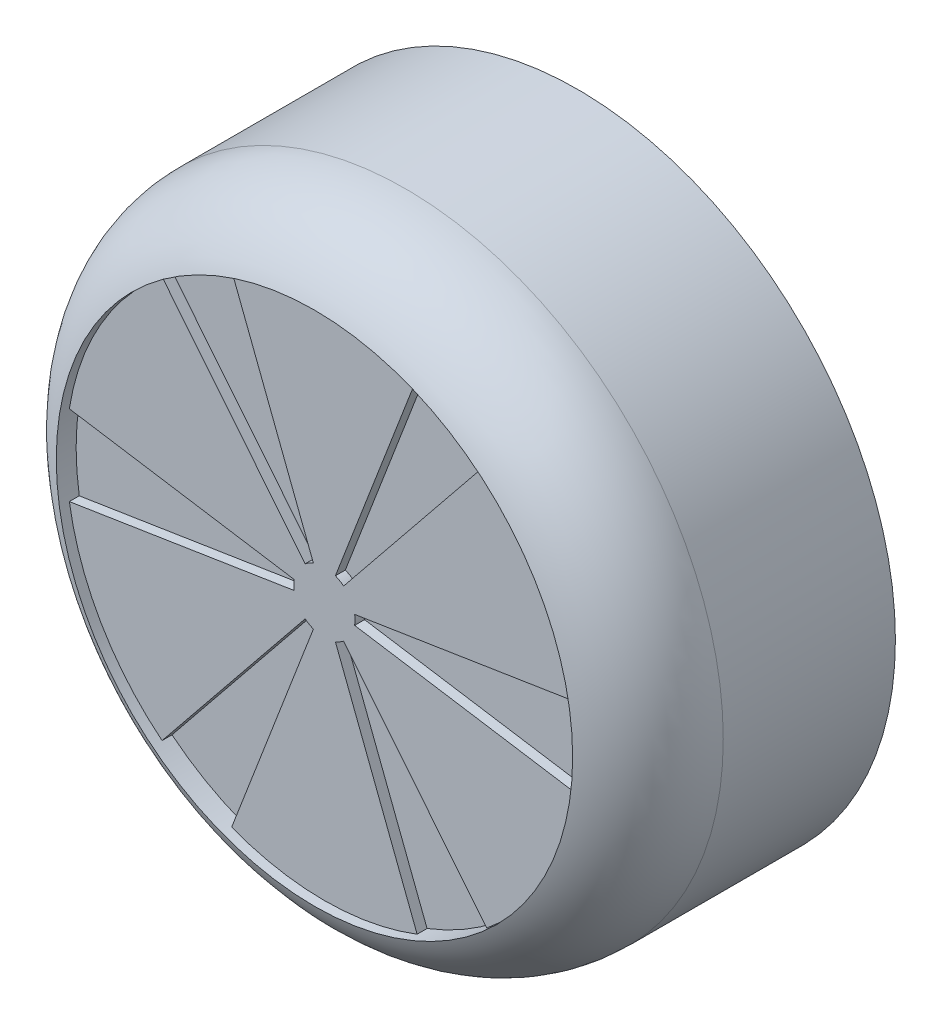
from build123d import *

# Parameters (mm, degrees)
SKETCH_1_R          = 32
EXTRUDE_1_DEPTH     = 26.5
CUT_EXTRUDE_4_DEPTH = 2
SKETCH_3_R          = 26
CUT_EXTRUDE_5_DEPTH = 1
FILLET_1_R          = 10
SKETCH_4_R          = 6.68863581
CUT_EXTRUDE_6_DEPTH = 5


with BuildPart() as part:
    # 草图1 → 凸台-拉伸1 (new body)
    with BuildSketch(Plane.XY):
        Circle(SKETCH_1_R)
    extrude(amount=EXTRUDE_1_DEPTH)

    # 草图2 → 切除-拉伸4 (cut)
    with BuildSketch(Plane.XY.offset(26.5)):
        with BuildLine():
            ThreePointArc((3.045475662, 0.479690306), (3.083022023, 0), (3.045475662, -0.479690306))
            Line((3.045475662, -0.479690306), (25.683360874, -4.045364533))
            ThreePointArc((25.683360874, -4.045364533), (26, 0), (25.683360874, 4.045364533))
            Line((25.683360874, 4.045364533), (3.045475662, 0.479690306))
        make_face()
        with BuildLine():
            Line((16.34506889, -20.219760705), (1.938161822, -2.397614137))
            ThreePointArc((1.938161822, -2.397614137), (1.541511012, -2.669975393), (1.10731384, -2.877304443))
            Line((1.10731384, -2.877304443), (9.338291984, -24.265125238))
            ThreePointArc((9.338291984, -24.265125238), (13, -22.516660498), (16.34506889, -20.219760705))
        make_face()
        with BuildLine():
            Line((-9.338291984, -24.265125238), (-1.10731384, -2.877304443))
            ThreePointArc((-1.10731384, -2.877304443), (-1.541511012, -2.669975393), (-1.938161822, -2.397614137))
            Line((-1.938161822, -2.397614137), (-16.34506889, -20.219760705))
            ThreePointArc((-16.34506889, -20.219760705), (-13, -22.516660498), (-9.338291984, -24.265125238))
        make_face()
        with BuildLine():
            Line((-25.683360874, -4.045364533), (-3.045475662, -0.479690306))
            ThreePointArc((-3.045475662, -0.479690306), (-3.083022023, 0), (-3.045475662, 0.479690306))
            Line((-3.045475662, 0.479690306), (-25.683360874, 4.045364533))
            ThreePointArc((-25.683360874, 4.045364533), (-26, 0), (-25.683360874, -4.045364533))
        make_face()
        with BuildLine():
            Line((-16.34506889, 20.219760705), (-1.938161822, 2.397614137))
            ThreePointArc((-1.938161822, 2.397614137), (-1.541511012, 2.669975393), (-1.10731384, 2.877304443))
            Line((-1.10731384, 2.877304443), (-9.338291984, 24.265125238))
            ThreePointArc((-9.338291984, 24.265125238), (-13, 22.516660498), (-16.34506889, 20.219760705))
        make_face()
        with BuildLine():
            Line((9.338291984, 24.265125238), (1.10731384, 2.877304443))
            ThreePointArc((1.10731384, 2.877304443), (1.541511012, 2.669975393), (1.938161822, 2.397614137))
            Line((1.938161822, 2.397614137), (16.34506889, 20.219760705))
            ThreePointArc((16.34506889, 20.219760705), (13, 22.516660498), (9.338291984, 24.265125238))
        make_face()
    extrude(amount=-CUT_EXTRUDE_4_DEPTH, mode=Mode.SUBTRACT)

    # 草图3 → 切除-拉伸5 (cut)
    with BuildSketch(Plane.XY.offset(26.5)):
        Circle(SKETCH_3_R)
    extrude(amount=-CUT_EXTRUDE_5_DEPTH, mode=Mode.SUBTRACT)

    # 圆角1
    # the kernel refuses this fillet: 10 mm, written as the material it takes off along each edge
    with BuildSketch(Plane(origin=(0, 0, 26.5), x_dir=(1, 0, 0), z_dir=(0, -1, 0))) as fillet_1_piece_1:
        with BuildLine():
            CenterArc((22, -9.16515139), FILLET_1_R, 0, 66.421821522)
            Line((26, 0), (26.08, 0.183303028))
            ThreePointArc((26.08, 0.183303028), (29, 0.2), (32, 0.2))
            Line((32, 0.2), (32.2, 0))
            Line((32.2, 0), (32.2, -9.16515139))
            Line((32.2, -9.16515139), (32, -9.16515139))
        make_face()
    revolve(axis=Axis((0, 0, 26.5), (0, 0, 1)), mode=Mode.SUBTRACT)

    # 草图4 → 切除-拉伸6 (cut)
    with BuildSketch(Plane(origin=(0, 0, 0), x_dir=(-1, 0, 0), z_dir=(0, 0, -1))):
        Circle(SKETCH_4_R)
    extrude(amount=-CUT_EXTRUDE_6_DEPTH, mode=Mode.SUBTRACT)


solid = part.part
